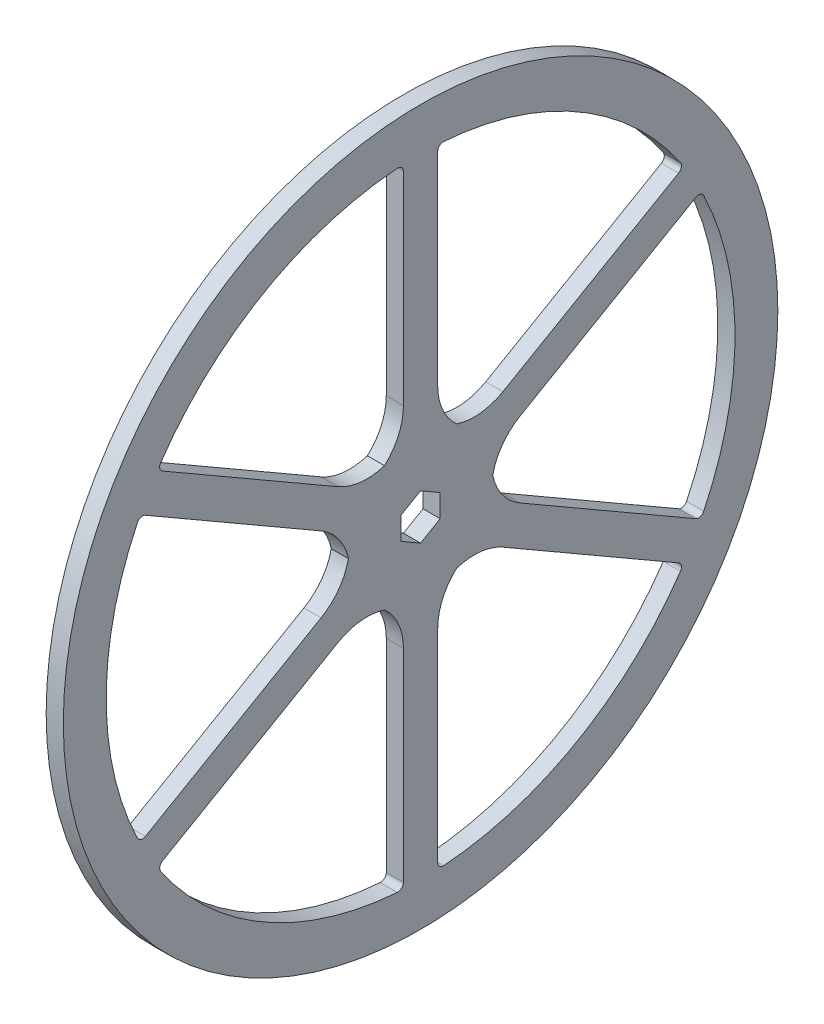
from build123d import *

# Parameters (mm, degrees)
SKETCH1_R           = 62.5
BOSS_EXTRUDE1_DEPTH = 3
CUT_EXTRUDE5_DEPTH  = 89.439244682
CIRPATTERN4_COUNT   = 6
CUT_EXTRUDE6_DEPTH  = 89.439244682
FILLET1_R           = 10
FILLET2_R           = 1


with BuildPart() as part:
    # Sketch1 → Boss-Extrude1 (new body)
    with BuildSketch(Plane(origin=(0, 0, 0), x_dir=(0, 0, -1), z_dir=(1, 0, 0))):
        Circle(SKETCH1_R)
    extrude(amount=BOSS_EXTRUDE1_DEPTH)

    # Sketch6 → Cut-Extrude5 (cut, through all)
    with BuildSketch(Plane.ZY):
        with BuildLine():
            Line((-3, 54.918120871), (-3, 12.1346611))
            ThreePointArc((-3, 12.1346611), (-6.25, 10.825317547), (-9.008924778, 8.665406761))
            Line((-9.008924778, 8.665406761), (-46.060487802, 30.057136647))
            ThreePointArc((-46.060487802, 30.057136647), (-27.5, 47.631397208), (-3, 54.918120871))
        make_face()
    cut_extrude5 = extrude(amount=-CUT_EXTRUDE5_DEPTH, mode=Mode.SUBTRACT)

    # CirPattern4: Cut-Extrude5 ×6 about axis
    cirpattern4_axis = Axis((0, 0, 0), (1, 0, 0))
    for i in range(1, CIRPATTERN4_COUNT):
        add(cut_extrude5.rotate(cirpattern4_axis, i * 360 / CIRPATTERN4_COUNT), mode=Mode.SUBTRACT)

    # Sketch7 → Cut-Extrude6 (cut, through all)
    with BuildSketch(Plane.ZY):
        Polygon((0, 3.960622847), (-3.43, 1.980311423), (-3.43, -1.980311423), (0, -3.960622847), (3.43, -1.980311423), (3.43, 1.980311423), align=None)
    extrude(amount=-CUT_EXTRUDE6_DEPTH, mode=Mode.SUBTRACT)

    # Fillet1
    # the kernel refuses this fillet: 10 mm, written as the material it adds along each edge
    with BuildSketch(Plane(origin=(0, 12.1346611, 3), x_dir=(0, 1, 0), z_dir=(1, 0, 0)), Plane(origin=(0, 3.469254338, 12.008924778), x_dir=(0, 0.5000000000000027, 0.8660254037844372), z_dir=(1, 0, 0)), Plane(origin=(0, -8.665406761, 9.008924778), x_dir=(0, -0.4999999999999975, 0.8660254037844402), z_dir=(1, 0, 0)), Plane(origin=(0, -12.1346611, -3), x_dir=(0, -1, 0), z_dir=(1, 0, 0)), Plane(origin=(0, -3.469254338, -12.008924778), x_dir=(0, -0.500000000000002, -0.8660254037844375), z_dir=(1, 0, 0)), Plane(origin=(0, 8.665406761, -9.008924778), x_dir=(0, 0.4999999999999975, -0.86602540378444), z_dir=(1, 0, 0))) as fillet1_piece_1:
        with BuildLine():
            CenterArc((6.229706573, 10), FILLET1_R, 215.294394677, 54.705605323)
            ThreePointArc((-1.932234615, 4.222222222), (-0.768344169, 2.201618925), (0, 0))
            Line((0, 0), (6.229706573, 0))
        make_face()
    extrude(amount=3)
    with BuildSketch(Plane(origin=(0, 8.665406761, 9.008924778), x_dir=(0, 0.5000000000000008, 0.8660254037844382), z_dir=(1, 0, 0)), Plane(origin=(0, -3.469254338, 12.008924778), x_dir=(0, -0.49999999999999983, 0.8660254037844387), z_dir=(1, 0, 0)), Plane(origin=(0, -12.1346611, 3), x_dir=(0, -1, 0), z_dir=(1, 0, 0)), Plane(origin=(0, -8.665406761, -9.008924778), x_dir=(0, -0.5000000000000001, -0.8660254037844385), z_dir=(1, 0, 0)), Plane(origin=(0, 3.469254338, -12.008924778), x_dir=(0, 0.5000000000000001, -0.8660254037844385), z_dir=(1, 0, 0)), Plane(origin=(0, 12.1346611, -3), x_dir=(0, 1, 0), z_dir=(1, 0, 0))) as fillet1_piece_2:
        with BuildLine():
            CenterArc((6.229706573, -10), FILLET1_R, 90, 54.705605323)
            ThreePointArc((-1.932234615, -4.222222222), (-0.768344169, -2.201618925), (0, 0))
            Line((0, 0), (6.229706573, 0))
        make_face()
    extrude(amount=3)

    # Fillet2
    fillet2_edges = [part.edges().sort_by_distance(p)[0] for p in [
        (1.5, 54.918120871, -3),
        (1.5, -54.918120871, -3),
        (1.5, -30.057136647, -46.060487802),
        (1.5, -30.057136647, 46.060487802),
        (1.5, -54.918120871, 3),
        (1.5, 54.918120871, 3),
        (1.5, 30.057136647, 46.060487802),
        (1.5, 24.860984224, 49.060487802),
        (1.5, -24.860984224, 49.060487802),
        (1.5, -24.860984224, -49.060487802),
        (1.5, 24.860984224, -49.060487802),
        (1.5, 30.057136647, -46.060487802),
    ]]
    fillet(fillet2_edges, radius=FILLET2_R)


solid = part.part
